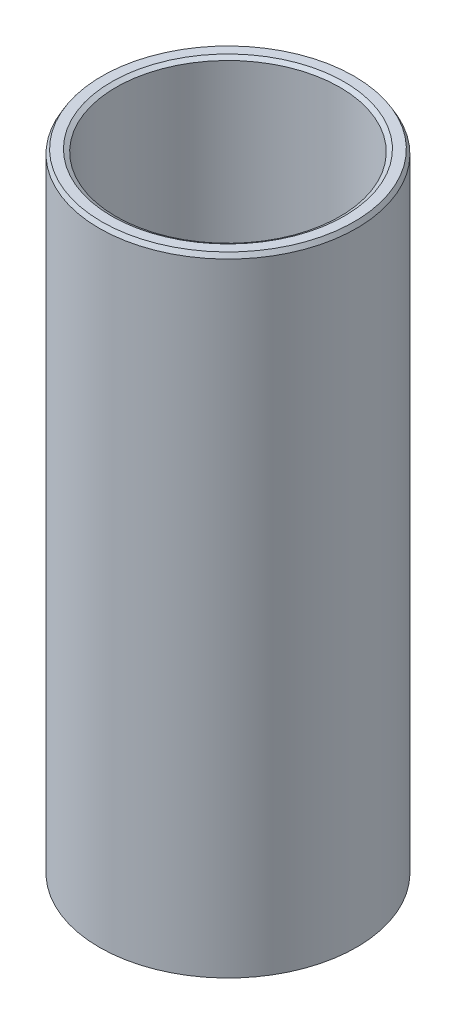
from build123d import *
from OCP.BRepFilletAPI import BRepFilletAPI_MakeChamfer

# Parameters (mm, degrees)
SKETCH1_R           = 47.5
BOSS_EXTRUDE1_DEPTH = 232.376794149
SKETCH2_R           = 41.32800445
CUT_EXTRUDE1_DEPTH  = 242.891451811
CHAMFER1_SIZE       = 1.617938172
CHAMFER1_SIZE2      = 0.934117039


with BuildPart() as part:
    # Sketch1 → Boss-Extrude1 (new body)
    with BuildSketch(Plane(origin=(0, 0, 0), x_dir=(1, 0, 0), z_dir=(0, 1, 0))):
        Circle(SKETCH1_R)
    extrude(amount=BOSS_EXTRUDE1_DEPTH)

    # Sketch2 → Cut-Extrude1 (cut, through all)
    with BuildSketch(Plane(origin=(0, 0, 0), x_dir=(1, 0, 0), z_dir=(0, 1, 0))):
        Circle(SKETCH2_R)
    extrude(amount=CUT_EXTRUDE1_DEPTH, mode=Mode.SUBTRACT)

    # Chamfer1: one chamfer whose edges measure the first distance from different faces: ONE call of the kernel's chamfer builder (chamfer() names one face for all edges)
    chamfer1_edges_1 = [part.edges().sort_by_distance(p)[0] for p in [
        (-41.32800445, 232.376794149, 0),
    ]]
    chamfer1_side_1 = [part.faces().sort_by_distance(p)[0] for p in [
        (-46.156497116, 232.376794149, 0),
    ]]
    chamfer1_edges_2 = [part.edges().sort_by_distance(p)[0] for p in [
        (-41.32800445, 0, 0),
    ]]
    chamfer1_side_2 = [part.faces().sort_by_distance(p)[0] for p in [
        (-41.32800445, 116.188397075, 0),
    ]]
    chamfer1_edges_3 = [part.edges().sort_by_distance(p)[0] for p in [
        (-47.5, 0, 0),
    ]]
    chamfer1_side_3 = [part.faces().sort_by_distance(p)[0] for p in [
        (-46.156497116, 0, 0),
    ]]
    chamfer1_edges_4 = [part.edges().sort_by_distance(p)[0] for p in [
        (-47.5, 232.376794149, 0),
    ]]
    chamfer1_side_4 = [part.faces().sort_by_distance(p)[0] for p in [
        (-47.5, 116.188397075, 0),
    ]]
    chamfer1 = BRepFilletAPI_MakeChamfer(part.part.solid().wrapped)
    for e in chamfer1_edges_1:
        chamfer1.Add(CHAMFER1_SIZE, CHAMFER1_SIZE2, e.wrapped, chamfer1_side_1[0].wrapped)  # the first distance lies on this face
    for e in chamfer1_edges_2:
        chamfer1.Add(CHAMFER1_SIZE, CHAMFER1_SIZE2, e.wrapped, chamfer1_side_2[0].wrapped)  # the first distance lies on this face
    for e in chamfer1_edges_3:
        chamfer1.Add(CHAMFER1_SIZE, CHAMFER1_SIZE2, e.wrapped, chamfer1_side_3[0].wrapped)  # the first distance lies on this face
    for e in chamfer1_edges_4:
        chamfer1.Add(CHAMFER1_SIZE, CHAMFER1_SIZE2, e.wrapped, chamfer1_side_4[0].wrapped)  # the first distance lies on this face
    add(Compound.cast(chamfer1.Shape()), mode=Mode.REPLACE)


solid = part.part
